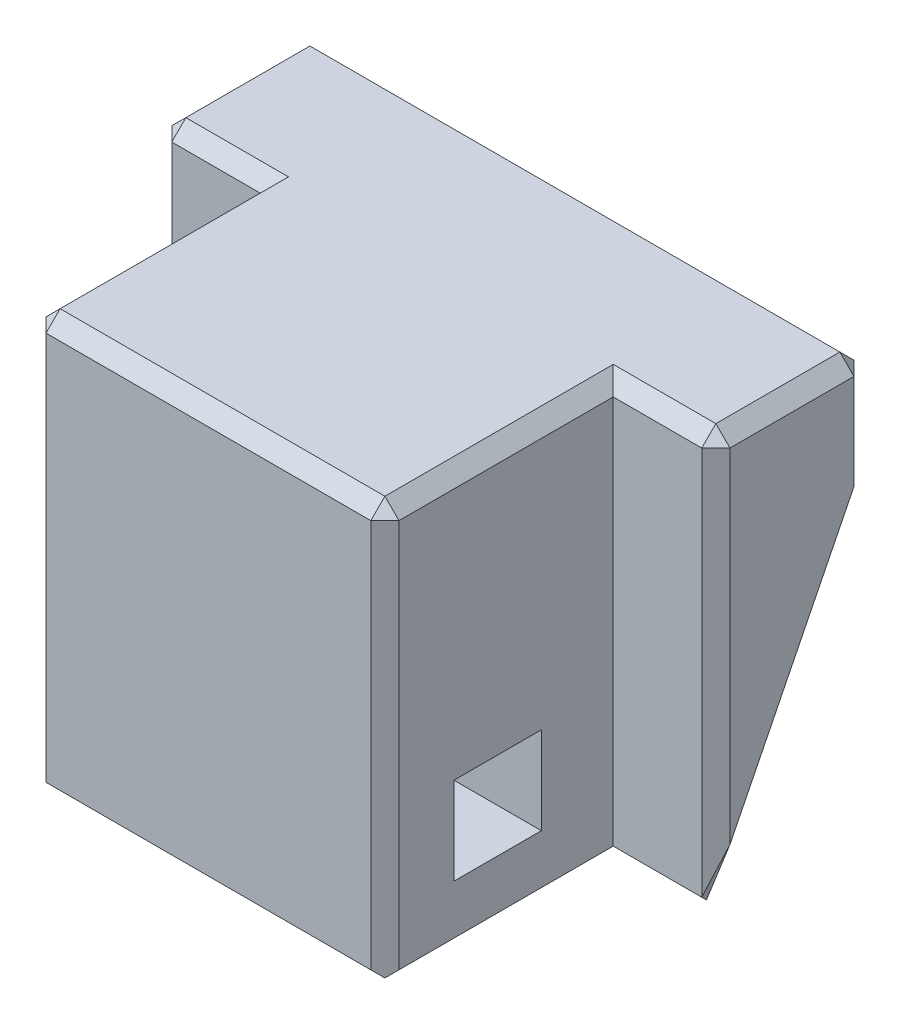
from build123d import *

# Parameters (mm, degrees)
BOSS_EXTRUDE1_DEPTH      = 6.260392
BOSS_EXTRUDE1_DEPTH_BACK = 6.260392
SKETCH4_W                = 8.1
SKETCH4_H                = 14.8
SKETCH4_W_2              = 3.1
SKETCH4_H_2              = 3.1
BOSS_EXTRUDE2_DEPTH      = 9.9
BOSS_EXTRUDE2_DEPTH_BACK = 9.9
CHAMFER2_SIZE            = 0.5


with BuildPart() as part:
    # Sketch4 → Boss-Extrude1 (new, two sides: drawn at the far end of the back side and taken through both)
    with BuildSketch(Plane(origin=(25.940071358, 0, 0), x_dir=(0, 0, -1), z_dir=(1, 0, 0)).offset(-BOSS_EXTRUDE1_DEPTH_BACK)):
        with Locations((-38.743556796, 146.174028513)):
            Rectangle(SKETCH4_W, SKETCH4_H)
        with Locations((-38.793556796, 142.574028513)):
            Rectangle(SKETCH4_W_2, SKETCH4_H_2, mode=Mode.SUBTRACT)
    extrude(amount=BOSS_EXTRUDE1_DEPTH + BOSS_EXTRUDE1_DEPTH_BACK)

    # Sketch4<5> → Boss-Extrude2 (add, two sides: drawn at the far end of the back side and taken through both)
    with BuildSketch(Plane(origin=(25.940071358, 0, 0), x_dir=(0, 0, -1), z_dir=(1, 0, 0)).offset(-BOSS_EXTRUDE2_DEPTH_BACK)):
        Polygon((-34.693556796, 153.574028513), (-34.693556796, 138.774028513), (-29.293556796, 149.574028513), (-29.293556796, 153.574028513), align=None)
    extrude(amount=BOSS_EXTRUDE2_DEPTH + BOSS_EXTRUDE2_DEPTH_BACK)

    # Chamfer1
    # the kernel refuses this chamfer: 0.5, 0.372677996 mm, written as the material it takes off along each edge
    with BuildSketch(Plane(origin=(20.013012691, 153.240695179, 42.460223463), x_dir=(0, 0.7071067811865475, -0.7071067811865475), z_dir=(-0.5773502691896258, 0.5773502691896258, 0.5773502691896258)), Plane(origin=(35.506738024, 153.240695179, 29.62689013), x_dir=(0.7071067811865475, -0.7071067811865475, 0), z_dir=(0.5773502691896258, 0.5773502691896258, -0.5773502691896258)), Plane(origin=(16.373404691, 153.240695179, 29.62689013), x_dir=(0, -0.7071067811865475, -0.7071067811865475), z_dir=(-0.5773502691896258, 0.5773502691896258, -0.5773502691896258))) as chamfer1_piece_1:
        Polygon((-0.353553391, -0.204124145), (0.353553391, -0.204124145), (0, 0.40824829), align=None)
    extrude(amount=0.635085296, mode=Mode.SUBTRACT)
    with BuildSketch(Plane(origin=(31.867130024, 153.240695179, 42.460223463), x_dir=(0, 0.7071067811865475, -0.7071067811865475), z_dir=(0.5773502691896258, 0.5773502691896258, 0.5773502691896258)), Plane(origin=(35.506738024, 153.240695179, 34.360223463), x_dir=(0, 0.7071067811865475, -0.7071067811865475), z_dir=(0.5773502691896258, 0.5773502691896258, 0.5773502691896258)), Plane(origin=(16.373404691, 153.240695179, 34.360223463), x_dir=(0, -0.7071067811865475, 0.7071067811865475), z_dir=(-0.5773502691896258, 0.5773502691896258, 0.5773502691896258))) as chamfer1_piece_2:
        Polygon((-0.353553391, 0.204124145), (0.353553391, 0.204124145), (0, -0.40824829), align=None)
    extrude(amount=0.635085296, mode=Mode.SUBTRACT)
    with BuildSketch(Plane(origin=(35.506738024, 139.75781762, 34.471334574), x_dir=(0, -0.7071067811865777, -0.7071067811865174), z_dir=(0.9485360198619486, -0.223918979794528, 0.22391897979454709))) as chamfer1_piece_3:
        Polygon((0.184955718, -0.526311482), (0.420657979, -0.526311482), (-0.605613697, 1.052622965), align=None)
    extrude(amount=0.64485025, mode=Mode.SUBTRACT)
    with BuildSketch(Plane(origin=(16.373404691, 139.75781762, 34.471334574), x_dir=(0, 0.7071067811865777, 0.7071067811865174), z_dir=(-0.9485360198619486, -0.223918979794528, 0.22391897979454709))) as chamfer1_piece_4:
        Polygon((-0.420657979, -0.526311482), (-0.184955718, -0.526311482), (0.605613697, 1.052622965), align=None)
    extrude(amount=0.64485025, mode=Mode.SUBTRACT)
    with BuildSketch(Plane(origin=(18.393837864, 138.774028513, 42.793556796), x_dir=(0, 0.999621916911297, 0.027495876610582292), z_dir=(1, 0, 0)), Plane(origin=(18.393837864, 153.574028513, 42.793556796), x_dir=(0, 0.02749587661058229, -0.9996219169112968), z_dir=(1, 0, 0))) as chamfer1_piece_5:
        with BuildLine():
            Line((0.514336598, 0), (-0.028273577, -0.513558897))
            Line((-0.028273577, -0.513558897), (-0.038269797, -0.513283938))
            ThreePointArc((-0.038269797, -0.513283938), (-0.017064614, -0.256698915), (-0.009996219, 0.000274959))
            Line((-0.009996219, 0.000274959), (0.000274959, 0.009996219))
            ThreePointArc((0.000274959, 0.009996219), (0.257248832, 0.002927825), (0.514611556, 0.009996219))
            Line((0.514611556, 0.009996219), (0.514336598, 0))
        make_face()
    extrude(amount=15.092466988, mode=Mode.SUBTRACT)
    with BuildSketch(Plane(origin=(32.200463358, 154.859870007, 42.793556796), x_dir=(0.02749587661058229, 0, -0.9996219169112968), z_dir=(0, -1, 0)), Plane(origin=(19.679679358, 154.859870007, 42.793556796), x_dir=(0.999621916911297, 0, 0.027495876610582105), z_dir=(0, -1, 0)), Plane(origin=(16.040071358, 154.859870007, 34.693556796), x_dir=(0.999621916911297, 0, 0.027495876610582105), z_dir=(0, -1, 0))) as chamfer1_piece_6:
        with BuildLine():
            Line((0.514336598, 0), (-0.028273577, -0.513558897))
            Line((-0.028273577, -0.513558897), (-0.038269797, -0.513283938))
            ThreePointArc((-0.038269797, -0.513283938), (-0.017064614, -0.256698915), (-0.009996219, 0.000274959))
            Line((-0.009996219, 0.000274959), (0.000274959, 0.009996219))
            ThreePointArc((0.000274959, 0.009996219), (0.257248832, 0.002927825), (0.514611556, 0.009996219))
            Line((0.514611556, 0.009996219), (0.514336598, 0))
        make_face()
    extrude(amount=17.371682988, mode=Mode.SUBTRACT)
    with BuildSketch(Plane(origin=(32.200463358, 153.574028513, 34.693556796), x_dir=(-0.999621916911297, 0.027495876610582105, 0), z_dir=(0, 0, 1))) as chamfer1_piece_7:
        with BuildLine():
            Line((0.514336598, 0), (-0.028273577, 0.513558897))
            Line((-0.028273577, 0.513558897), (-0.038269797, 0.513283938))
            ThreePointArc((-0.038269797, 0.513283938), (-0.017064614, 0.256698915), (-0.009996219, -0.000274959))
            Line((-0.009996219, -0.000274959), (0.000274959, -0.009996219))
            ThreePointArc((0.000274959, -0.009996219), (0.257248832, -0.002927825), (0.514611556, -0.009996219))
            Line((0.514611556, -0.009996219), (0.514336598, 0))
        make_face()
    extrude(amount=9.385841494, mode=Mode.SUBTRACT)
    with BuildSketch(Plane(origin=(19.679679358, 153.574028513, 34.693556796), x_dir=(0.999621916911297, 0.027495876610582105, 0), z_dir=(0, 0, 1))) as chamfer1_piece_8:
        with BuildLine():
            Line((0.514336598, 0), (-0.028273577, -0.513558897))
            Line((-0.028273577, -0.513558897), (-0.038269797, -0.513283938))
            ThreePointArc((-0.038269797, -0.513283938), (-0.017064614, -0.256698915), (-0.009996219, 0.000274959))
            Line((-0.009996219, 0.000274959), (0.000274959, 0.009996219))
            ThreePointArc((0.000274959, 0.009996219), (0.257248832, 0.002927825), (0.514611556, 0.009996219))
            Line((0.514611556, 0.009996219), (0.514336598, 0))
        make_face()
    extrude(amount=9.385841494, mode=Mode.SUBTRACT)
    with BuildSketch(Plane(origin=(37.125912852, 153.574028513, 34.693556796), x_dir=(0, -0.999621916911297, 0.027495876610582292), z_dir=(-1, 0, 0))) as chamfer1_piece_9:
        with BuildLine():
            Line((0.514336598, 0), (-0.028273577, -0.513558897))
            Line((-0.028273577, -0.513558897), (-0.038269797, -0.513283938))
            ThreePointArc((-0.038269797, -0.513283938), (-0.017064614, -0.256698915), (-0.009996219, 0.000274959))
            Line((-0.009996219, 0.000274959), (0.000274959, 0.009996219))
            ThreePointArc((0.000274959, 0.009996219), (0.257248832, 0.002927825), (0.514611556, 0.009996219))
            Line((0.514611556, 0.009996219), (0.514336598, 0))
        make_face()
    extrude(amount=4.925449494, mode=Mode.SUBTRACT)
    with BuildSketch(Plane(origin=(35.840071358, 153.574028513, 28.007715302), x_dir=(-0.999621916911297, 0.027495876610582292, 0), z_dir=(0, 0, 1))) as chamfer1_piece_10:
        with BuildLine():
            Line((0.514336598, 0), (-0.028273577, 0.513558897))
            Line((-0.028273577, 0.513558897), (-0.038269797, 0.513283938))
            ThreePointArc((-0.038269797, 0.513283938), (-0.017064614, 0.256698915), (-0.009996219, -0.000274959))
            Line((-0.009996219, -0.000274959), (0.000274959, -0.009996219))
            ThreePointArc((0.000274959, -0.009996219), (0.257248832, -0.002927825), (0.514611556, -0.009996219))
            Line((0.514611556, -0.009996219), (0.514336598, 0))
        make_face()
    extrude(amount=7.971682988, mode=Mode.SUBTRACT)
    with BuildSketch(Plane(origin=(37.125912852, 153.574028513, 29.293556796), x_dir=(0, 0.027495876610582105, 0.999621916911297), z_dir=(-1, 0, 0))) as chamfer1_piece_11:
        with BuildLine():
            Line((0.514336598, 0), (-0.028273577, -0.513558897))
            Line((-0.028273577, -0.513558897), (-0.038269797, -0.513283938))
            ThreePointArc((-0.038269797, -0.513283938), (-0.017064614, -0.256698915), (-0.009996219, 0.000274959))
            Line((-0.009996219, 0.000274959), (0.000274959, 0.009996219))
            ThreePointArc((0.000274959, 0.009996219), (0.257248832, 0.002927825), (0.514611556, 0.009996219))
            Line((0.514611556, 0.009996219), (0.514336598, 0))
        make_face()
    extrude(amount=22.371682988, mode=Mode.SUBTRACT)
    with BuildSketch(Plane(origin=(16.040071358, 153.574028513, 28.007715302), x_dir=(0.999621916911297, 0.027495876610582105, 0), z_dir=(0, 0, 1))) as chamfer1_piece_12:
        with BuildLine():
            Line((0.514336598, 0), (-0.028273577, -0.513558897))
            Line((-0.028273577, -0.513558897), (-0.038269797, -0.513283938))
            ThreePointArc((-0.038269797, -0.513283938), (-0.017064614, -0.256698915), (-0.009996219, 0.000274959))
            Line((-0.009996219, 0.000274959), (0.000274959, 0.009996219))
            ThreePointArc((0.000274959, 0.009996219), (0.257248832, 0.002927825), (0.514611556, 0.009996219))
            Line((0.514611556, 0.009996219), (0.514336598, 0))
        make_face()
    extrude(amount=7.971682988, mode=Mode.SUBTRACT)
    with BuildSketch(Plane(origin=(35.840071358, 148.288187019, 29.293556796), x_dir=(0.027495876610582105, 0, 0.999621916911297), z_dir=(0, 1, 0)), Plane(origin=(16.040071358, 148.288187019, 29.293556796), x_dir=(0.9996219169112968, 0, -0.027495876610589005), z_dir=(0, 1, 0))) as chamfer1_piece_13:
        with BuildLine():
            Line((0.514336598, 0), (-0.028273577, -0.513558897))
            Line((-0.028273577, -0.513558897), (-0.038269797, -0.513283938))
            ThreePointArc((-0.038269797, -0.513283938), (-0.017064614, -0.256698915), (-0.009996219, 0.000274959))
            Line((-0.009996219, 0.000274959), (0.000274959, 0.009996219))
            ThreePointArc((0.000274959, 0.009996219), (0.257248832, 0.002927825), (0.514611556, 0.009996219))
            Line((0.514611556, 0.009996219), (0.514336598, 0))
        make_face()
    extrude(amount=6.571682988, mode=Mode.SUBTRACT)
    with BuildSketch(Plane(origin=(35.840071358, 137.623936917, 35.268602594), x_dir=(-0.999621916911297, -0.012296529840442863, -0.024593059680883298), z_dir=(0, 0.8944271909998982, -0.44721359549999323))) as chamfer1_piece_14:
        with BuildLine():
            Line((0.514336598, 0), (-0.028273577, 0.513558897))
            Line((-0.028273577, 0.513558897), (-0.038269797, 0.513283938))
            ThreePointArc((-0.038269797, 0.513283938), (-0.017064614, 0.256698915), (-0.009996219, -0.000274959))
            Line((-0.009996219, -0.000274959), (0.000274959, -0.009996219))
            ThreePointArc((0.000274959, -0.009996219), (0.257248832, -0.002927825), (0.514611556, -0.009996219))
            Line((0.514611556, -0.009996219), (0.514336598, 0))
        make_face()
    extrude(amount=14.646450066, mode=Mode.SUBTRACT)
    with BuildSketch(Plane(origin=(16.040071358, 137.623936917, 35.268602594), x_dir=(0.999621916911297, -0.012296529840442778, -0.024593059680883128), z_dir=(0, 0.8944271909998982, -0.44721359549999323))) as chamfer1_piece_15:
        with BuildLine():
            Line((0.514336598, 0), (-0.028273577, -0.513558897))
            Line((-0.028273577, -0.513558897), (-0.038269797, -0.513283938))
            ThreePointArc((-0.038269797, -0.513283938), (-0.017064614, -0.256698915), (-0.009996219, 0.000274959))
            Line((-0.009996219, 0.000274959), (0.000274959, 0.009996219))
            ThreePointArc((0.000274959, 0.009996219), (0.257248832, 0.002927825), (0.514611556, 0.009996219))
            Line((0.514611556, 0.009996219), (0.514336598, 0))
        make_face()
    extrude(amount=14.646450066, mode=Mode.SUBTRACT)
    with BuildSketch(Plane(origin=(19.679679358, 153.574028513, 34.693556796), x_dir=(0, 0.02749587661058229, -0.9996219169112968), z_dir=(-1, 0, 0))) as chamfer1_piece_16:
        with BuildLine():
            Line((0.514336598, 0), (-0.028273577, 0.513558897))
            Line((-0.028273577, 0.513558897), (-0.038269797, 0.513283938))
            ThreePointArc((-0.038269797, 0.513283938), (-0.017064614, 0.256698915), (-0.009996219, -0.000274959))
            Line((-0.009996219, -0.000274959), (0.000274959, -0.009996219))
            ThreePointArc((0.000274959, -0.009996219), (0.257248832, -0.002927825), (0.514611556, -0.009996219))
            Line((0.514611556, -0.009996219), (0.514336598, 0))
        make_face()
    extrude(amount=4.925449494, mode=Mode.SUBTRACT)
    with BuildSketch(Plane(origin=(35.840071358, 154.859870007, 34.693556796), x_dir=(-0.999621916911297, 0, 0.027495876610582292), z_dir=(0, -1, 0))) as chamfer1_piece_17:
        with BuildLine():
            Line((0.514336598, 0), (-0.028273577, 0.513558897))
            Line((-0.028273577, 0.513558897), (-0.038269797, 0.513283938))
            ThreePointArc((-0.038269797, 0.513283938), (-0.017064614, 0.256698915), (-0.009996219, -0.000274959))
            Line((-0.009996219, -0.000274959), (0.000274959, -0.009996219))
            ThreePointArc((0.000274959, -0.009996219), (0.257248832, -0.002927825), (0.514611556, -0.009996219))
            Line((0.514611556, -0.009996219), (0.514336598, 0))
        make_face()
    extrude(amount=17.371682988, mode=Mode.SUBTRACT)
    with BuildSketch(Plane(origin=(32.200463358, 138.774028513, 34.693556796), x_dir=(0, 0.999621916911297, 0.027495876610582292), z_dir=(1, 0, 0))) as chamfer1_piece_18:
        with BuildLine():
            Line((0.514336598, 0), (0.31409902, -0.189516883))
            Line((0.31409902, -0.189516883), (0.309382645, -0.198334808))
            ThreePointArc((0.309382645, -0.198334808), (0.156807481, -0.095210948), (-0.004716376, -0.008817925))
            Line((-0.004716376, -0.008817925), (0.000274959, 0.009996219))
            ThreePointArc((0.000274959, 0.009996219), (0.257248832, 0.002927825), (0.514611556, 0.009996219))
            Line((0.514611556, 0.009996219), (0.514336598, 0))
        make_face()
    extrude(amount=4.925449494, mode=Mode.SUBTRACT)
    with BuildSketch(Plane(origin=(14.754229864, 138.774028513, 34.693556796), x_dir=(0, 0.8700995906888151, -0.492875950197569), z_dir=(1, 0, 0))) as chamfer1_piece_19:
        with BuildLine():
            Line((0.366844441, 0), (0.440384543, 0.26571336))
            Line((0.440384543, 0.26571336), (0.435455784, 0.274414356))
            ThreePointArc((0.435455784, 0.274414356), (0.218748671, 0.135405143), (-0.00492876, 0.008700996))
            Line((-0.00492876, 0.008700996), (0.000517213, -0.009986616))
            ThreePointArc((0.000517213, -0.009986616), (0.183448762, -0.00051248), (0.367361654, -0.009986616))
            Line((0.367361654, -0.009986616), (0.366844441, 0))
        make_face()
    extrude(amount=4.925449494, mode=Mode.SUBTRACT)
    with BuildSketch(Plane(origin=(37.125912852, 153.574028513, 34.693556796), x_dir=(0, -0.999621916911297, 0.027495876610582292), z_dir=(-1, 0, 0))) as chamfer1_piece_20a_section:
        with BuildLine():
            Line((0.514336598, 0), (-0.028273577, -0.513558897))
            Line((-0.028273577, -0.513558897), (-0.038269797, -0.513283938))
            ThreePointArc((-0.038269797, -0.513283938), (-0.017064614, -0.256698915), (-0.009996219, 0.000274959))
            Line((-0.009996219, 0.000274959), (0.000274959, 0.009996219))
            ThreePointArc((0.000274959, 0.009996219), (0.257248832, 0.002927825), (0.514611556, 0.009996219))
            Line((0.514611556, 0.009996219), (0.514336598, 0))
        make_face()
    chamfer1_piece_20a = extrude(amount=6.211290988, mode=Mode.PRIVATE)
    chamfer1_piece_20a = split(chamfer1_piece_20a, bisect_by=Plane(origin=(32.200463358, 153.409131699, 34.528659983), z_dir=(-1, 0, 0)), keep=Keep.TOP, mode=Mode.PRIVATE)
    with BuildSketch(Plane(origin=(32.200463358, 153.574028513, 33.407715302), x_dir=(-0.999621916911297, 0.027495876610582105, 0), z_dir=(0, 0, 1))) as chamfer1_piece_20b_section:
        with BuildLine():
            Line((0.514336598, 0), (-0.028273577, 0.513558897))
            Line((-0.028273577, 0.513558897), (-0.038269797, 0.513283938))
            ThreePointArc((-0.038269797, 0.513283938), (-0.017064614, 0.256698915), (-0.009996219, -0.000274959))
            Line((-0.009996219, -0.000274959), (0.000274959, -0.009996219))
            ThreePointArc((0.000274959, -0.009996219), (0.257248832, -0.002927825), (0.514611556, -0.009996219))
            Line((0.514611556, -0.009996219), (0.514336598, 0))
        make_face()
    chamfer1_piece_20b = extrude(amount=10.671682988, mode=Mode.PRIVATE)
    chamfer1_piece_20b = split(chamfer1_piece_20b, bisect_by=Plane(origin=(32.035566544, 153.409131699, 34.693556796), z_dir=(0, 0, -1)), keep=Keep.TOP, mode=Mode.PRIVATE)
    chamfer1_piece_20 = chamfer1_piece_20a & chamfer1_piece_20b
    add(chamfer1_piece_20, mode=Mode.SUBTRACT)
    with BuildSketch(Plane(origin=(19.679679358, 153.574028513, 33.407715302), x_dir=(0.999621916911297, 0.027495876610582105, 0), z_dir=(0, 0, 1))) as chamfer1_piece_21a_section:
        with BuildLine():
            Line((0.514336598, 0), (-0.028273577, -0.513558897))
            Line((-0.028273577, -0.513558897), (-0.038269797, -0.513283938))
            ThreePointArc((-0.038269797, -0.513283938), (-0.017064614, -0.256698915), (-0.009996219, 0.000274959))
            Line((-0.009996219, 0.000274959), (0.000274959, 0.009996219))
            ThreePointArc((0.000274959, 0.009996219), (0.257248832, 0.002927825), (0.514611556, 0.009996219))
            Line((0.514611556, 0.009996219), (0.514336598, 0))
        make_face()
    chamfer1_piece_21a = extrude(amount=10.671682988, mode=Mode.PRIVATE)
    chamfer1_piece_21a = split(chamfer1_piece_21a, bisect_by=Plane(origin=(19.844576171, 153.409131699, 34.693556796), z_dir=(0, 0, -1)), keep=Keep.TOP, mode=Mode.PRIVATE)
    with BuildSketch(Plane(origin=(20.965520852, 153.574028513, 34.693556796), x_dir=(0, 0.02749587661058229, -0.9996219169112968), z_dir=(-1, 0, 0))) as chamfer1_piece_21b_section:
        with BuildLine():
            Line((0.514336598, 0), (-0.028273577, 0.513558897))
            Line((-0.028273577, 0.513558897), (-0.038269797, 0.513283938))
            ThreePointArc((-0.038269797, 0.513283938), (-0.017064614, 0.256698915), (-0.009996219, -0.000274959))
            Line((-0.009996219, -0.000274959), (0.000274959, -0.009996219))
            ThreePointArc((0.000274959, -0.009996219), (0.257248832, -0.002927825), (0.514611556, -0.009996219))
            Line((0.514611556, -0.009996219), (0.514336598, 0))
        make_face()
    chamfer1_piece_21b = extrude(amount=6.211290988, mode=Mode.PRIVATE)
    chamfer1_piece_21b = split(chamfer1_piece_21b, bisect_by=Plane(origin=(19.679679358, 153.409131699, 34.528659983), z_dir=(1, 0, 0)), keep=Keep.TOP, mode=Mode.PRIVATE)
    chamfer1_piece_21 = chamfer1_piece_21a & chamfer1_piece_21b
    add(chamfer1_piece_21, mode=Mode.SUBTRACT)

    # Chamfer2
    chamfer2_edges = [part.edges().sort_by_distance(p)[0] for p in [
        (32.200463358, 138.774028513, 38.493556796),
        (19.679679358, 138.774028513, 38.493556796),
    ]]
    chamfer(chamfer2_edges, length=CHAMFER2_SIZE)


solid = part.part
